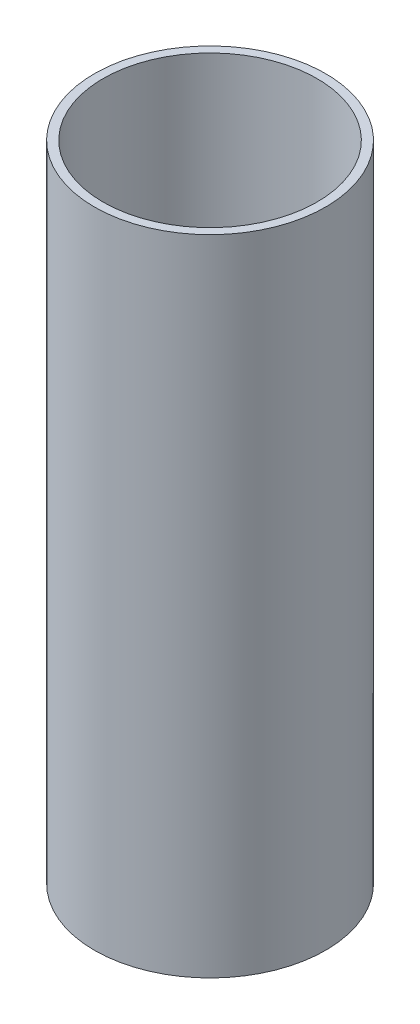
from build123d import *

# Parameters (mm, degrees)
SKETCH1_R           = 40.4
SKETCH1_R_2         = 37.4
BOSS_EXTRUDE1_DEPTH = 225


with BuildPart() as part:
    # Sketch1 → Boss-Extrude1 (new body)
    with BuildSketch(Plane(origin=(0, 0, 0), x_dir=(1, 0, 0), z_dir=(0, 1, 0))):
        Circle(SKETCH1_R)
        Circle(SKETCH1_R_2, mode=Mode.SUBTRACT)
    extrude(amount=BOSS_EXTRUDE1_DEPTH)


solid = part.part
